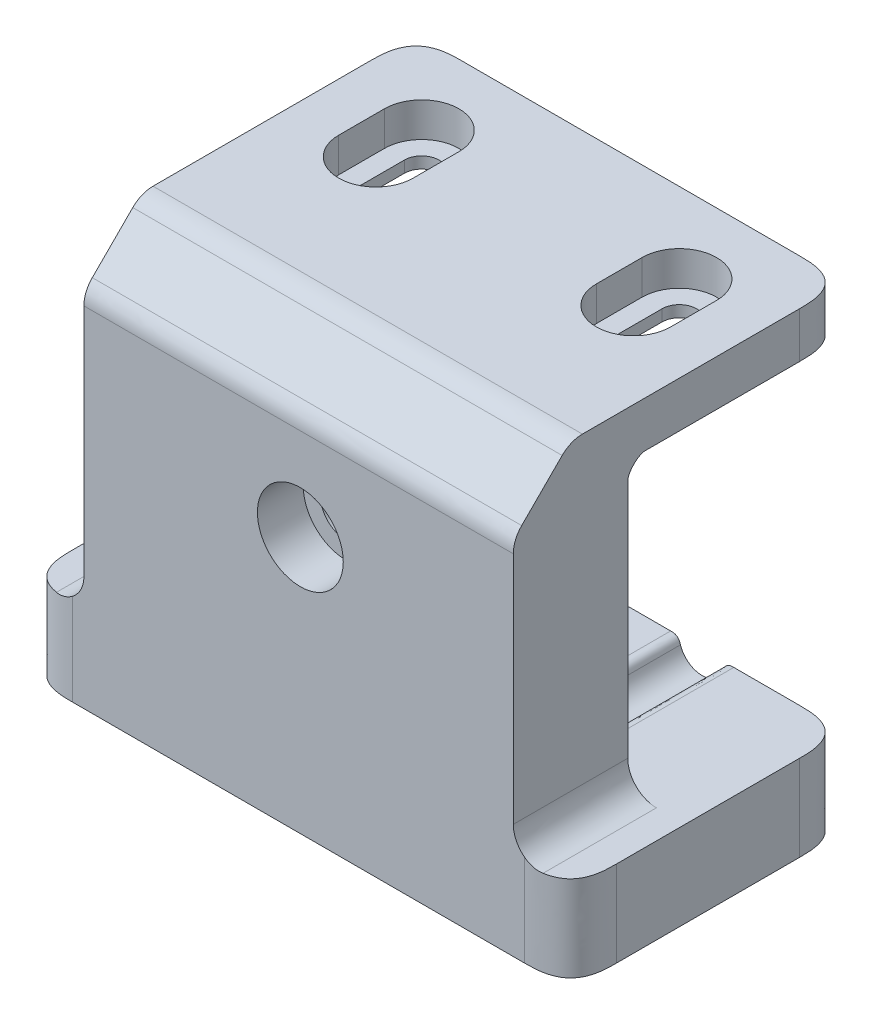
from build123d import *

# Parameters (mm, degrees)
BOSS_EXTRUDE1_DEPTH            = 37.5
SKETCH2_W                      = 10
SKETCH2_H                      = 58
BOSS_EXTRUDE2_DEPTH            = 15
CUT_EXTRUDE1_DEPTH             = 60
SKETCH4_W                      = 117.065560194
SKETCH4_H                      = 19.652824348
CUT_EXTRUDE2_DEPTH             = 60
FILLET2_SIZE                   = 5
FILLET3_SIZE                   = 3
FILLET4_SIZE                   = 8
CUT_EXTRUDE3_DEPTH             = 6
SKETCH6_R                      = 4
CUT_EXTRUDE4_DEPTH             = 28
FILLET5_START                  = 9
FILLET5_DEPTH                  = 29
CBORE_FOR_M8_SHCS1_D           = 9
CBORE_FOR_M8_SHCS1_CBORE_D     = 15
CBORE_FOR_M8_SHCS1_CBORE_DEPTH = 8


with BuildPart() as part:
    # Sketch1 → Boss-Extrude1 (new, symmetric)
    with BuildSketch(Plane(origin=(0, 0, 0), x_dir=(0, 0, -1), z_dir=(1, 0, 0))):
        Polygon((0, 0), (-38, 0), (-38, 50), (0, 50), (0, 58), (-48, 58), (-58, 48), (-58, -15), (0, -15), align=None)
    extrude(amount=BOSS_EXTRUDE1_DEPTH, both=True)

    # Sketch2 → Boss-Extrude2 (add)
    with BuildSketch(Plane(origin=(0, 0, 0), x_dir=(1, 0, 0), z_dir=(0, 1, 0))):
        with Locations((42.5, -29)):
            Rectangle(SKETCH2_W, SKETCH2_H)
        with Locations((-42.5, -29)):
            Rectangle(SKETCH2_W, SKETCH2_H)
    extrude(amount=-BOSS_EXTRUDE2_DEPTH)

    # Sketch3 → Cut-Extrude1 (cut)
    with BuildSketch(Plane(origin=(0, 58, 0), x_dir=(1, 0, 0), z_dir=(0, 1, 0))):
        with BuildLine():
            Line((25.5, -14), (25.5, -22))
            ThreePointArc((25.5, -22), (22.5, -25), (19.5, -22))
            Line((19.5, -22), (19.5, -14))
            ThreePointArc((19.5, -14), (22.5, -11), (25.5, -14))
        make_face()
        with BuildLine():
            Line((-25.5, -14), (-25.5, -22))
            ThreePointArc((-25.5, -22), (-22.5, -25), (-19.5, -22))
            Line((-19.5, -22), (-19.5, -14))
            ThreePointArc((-19.5, -14), (-22.5, -11), (-25.5, -14))
        make_face()
    extrude(amount=-CUT_EXTRUDE1_DEPTH, mode=Mode.SUBTRACT)

    # Sketch4 → Cut-Extrude2 (cut)
    with BuildSketch(Plane(origin=(0, 0, 0), x_dir=(1, 0, 0), z_dir=(0, 1, 0))):
        with Locations((0.461167358, -0.173587826)):
            Rectangle(SKETCH4_W, SKETCH4_H)
    extrude(amount=-CUT_EXTRUDE2_DEPTH, mode=Mode.SUBTRACT)

    # Fillet2
    # a fillet whose section is not a circle: 5 mm, written as the material it adds along each edge
    with BuildSketch(Plane(origin=(37.5, 0, 58), x_dir=(1, 0, 0), z_dir=(0, 0, -1))) as fillet2_piece_1:
        with BuildLine():
            Bezier((FILLET2_SIZE, 0), (0, 0), (0, -FILLET2_SIZE), weights=[1, 0.707106781, 1])
            Line((0, -FILLET2_SIZE), (0, 0))
            Line((0, 0), (FILLET2_SIZE, 0))
        make_face()
    extrude(amount=20)
    with BuildSketch(Plane(origin=(-37.5, 0, 58), x_dir=(-1, 0, 0), z_dir=(0, 0, -1))) as fillet2_piece_2:
        with BuildLine():
            Bezier((FILLET2_SIZE, 0), (0, 0), (0, FILLET2_SIZE), weights=[1, 0.707106781, 1])
            Line((0, FILLET2_SIZE), (0, 0))
            Line((0, 0), (FILLET2_SIZE, 0))
        make_face()
    extrude(amount=20)
    # a fillet whose section is not a circle: 5 mm, written as the material it takes off along each edge
    with BuildSketch(Plane(origin=(-42.67766953, 48, 58), x_dir=(0, 0.7071067811865492, -0.7071067811865458), z_dir=(1, 0, 0)), Plane(origin=(-42.67766953, 58, 48), x_dir=(0, 0, -1), z_dir=(1, 0, 0))) as fillet2_2_piece_1:
        with BuildLine():
            Bezier((2.071067812, 0), (0, 0), (-1.464466094, -1.464466094), weights=[1, 0.923879533, 1])
            Line((-1.464466094, -1.464466094), (0, 0))
            Line((0, 0), (2.071067812, 0))
        make_face()
    extrude(amount=85.355339059, mode=Mode.SUBTRACT)

    # Fillet3
    # a fillet whose section is not a circle: 3 mm, written as the material it adds along each edge
    with BuildSketch(Plane(origin=(-37.5, 50, 38), x_dir=(0, -1, 0), z_dir=(1, 0, 0))) as fillet3_piece_1:
        with BuildLine():
            Bezier((FILLET3_SIZE, 0), (0, 0), (0, FILLET3_SIZE), weights=[1, 0.424264069, 1])
            Line((0, FILLET3_SIZE), (0, 0))
            Line((0, 0), (FILLET3_SIZE, 0))
        make_face()
    extrude(amount=75)

    # Fillet4
    # a fillet whose section is not a circle: 8 mm, written as the material it takes off along each edge
    with BuildSketch(Plane(origin=(-37.5, 30, 0), x_dir=(0, 0, 1), z_dir=(0, 1, 0))) as fillet4_piece_1:
        with BuildLine():
            add(Edge.make_bspline([(FILLET4_SIZE, 0), (FILLET4_SIZE * 0.831801948466, 0), (FILLET4_SIZE * 0.663603896932, 0), (FILLET4_SIZE * 0.292893218813, FILLET4_SIZE * 0.0716919198361), (FILLET4_SIZE * 0.0716919198361, FILLET4_SIZE * 0.292893218813), (0, FILLET4_SIZE * 0.663603896932), (0, FILLET4_SIZE * 0.831801948466), (0, FILLET4_SIZE)], knots=[0, 0, 0, 0, 0, 0, 0.5, 0.5, 1, 1, 1, 1, 1, 1], degree=5))
            Line((0, FILLET4_SIZE), (0, 0))
            Line((0, 0), (FILLET4_SIZE, 0))
        make_face()
    extrude(amount=48, mode=Mode.SUBTRACT)
    with BuildSketch(Plane(origin=(37.5, 30, 0), x_dir=(0, 0, 1), z_dir=(0, 1, 0))) as fillet4_piece_2:
        with BuildLine():
            add(Edge.make_bspline([(FILLET4_SIZE, 0), (FILLET4_SIZE * 0.831801948466, 0), (FILLET4_SIZE * 0.663603896932, 0), (FILLET4_SIZE * 0.292893218813, -FILLET4_SIZE * 0.0716919198361), (FILLET4_SIZE * 0.0716919198361, -FILLET4_SIZE * 0.292893218813), (0, -FILLET4_SIZE * 0.663603896932), (0, -FILLET4_SIZE * 0.831801948466), (0, -FILLET4_SIZE)], knots=[0, 0, 0, 0, 0, 0, 0.5, 0.5, 1, 1, 1, 1, 1, 1], degree=5))
            Line((0, -FILLET4_SIZE), (0, 0))
            Line((0, 0), (FILLET4_SIZE, 0))
        make_face()
    extrude(amount=48, mode=Mode.SUBTRACT)
    with BuildSketch(Plane(origin=(-47.5, 20, 58), x_dir=(0, 0, -1), z_dir=(0, -1, 0)), Plane(origin=(47.5, 20, 58), x_dir=(-1, 0, 0), z_dir=(0, -1, 0)), Plane(origin=(47.5, 20, 10), x_dir=(0, 0, 1), z_dir=(0, -1, 0))) as fillet4_piece_3:
        with BuildLine():
            add(Edge.make_bspline([(FILLET4_SIZE, 0), (FILLET4_SIZE * 0.831801948466, 0), (FILLET4_SIZE * 0.663603896932, 0), (FILLET4_SIZE * 0.292893218813, FILLET4_SIZE * 0.0716919198361), (FILLET4_SIZE * 0.0716919198361, FILLET4_SIZE * 0.292893218813), (0, FILLET4_SIZE * 0.663603896932), (0, FILLET4_SIZE * 0.831801948466), (0, FILLET4_SIZE)], knots=[0, 0, 0, 0, 0, 0, 0.5, 0.5, 1, 1, 1, 1, 1, 1], degree=5))
            Line((0, FILLET4_SIZE), (0, 0))
            Line((0, 0), (FILLET4_SIZE, 0))
        make_face()
    extrude(amount=55, mode=Mode.SUBTRACT)
    with BuildSketch(Plane(origin=(-47.5, 20, 10), x_dir=(0, 0, 1), z_dir=(0, -1, 0))) as fillet4_piece_4:
        with BuildLine():
            add(Edge.make_bspline([(FILLET4_SIZE, 0), (FILLET4_SIZE * 0.831801948466, 0), (FILLET4_SIZE * 0.663603896932, 0), (FILLET4_SIZE * 0.292893218813, -FILLET4_SIZE * 0.0716919198361), (FILLET4_SIZE * 0.0716919198361, -FILLET4_SIZE * 0.292893218813), (0, -FILLET4_SIZE * 0.663603896932), (0, -FILLET4_SIZE * 0.831801948466), (0, -FILLET4_SIZE)], knots=[0, 0, 0, 0, 0, 0, 0.5, 0.5, 1, 1, 1, 1, 1, 1], degree=5))
            Line((0, -FILLET4_SIZE), (0, 0))
            Line((0, 0), (FILLET4_SIZE, 0))
        make_face()
    extrude(amount=55, mode=Mode.SUBTRACT)

    # Sketch5 → Cut-Extrude3 (cut)
    with BuildSketch(Plane(origin=(0, 58, 0), x_dir=(1, 0, 0), z_dir=(0, 1, 0))):
        with BuildLine():
            Line((29, -22), (29, -14))
            ThreePointArc((29, -14), (22.5, -7.5), (16, -14))
            Line((16, -14), (16, -22))
            ThreePointArc((16, -22), (22.5, -28.5), (29, -22))
        make_face()
        with BuildLine():
            Line((-29, -14), (-29, -22))
            ThreePointArc((-29, -22), (-22.5, -28.5), (-16, -22))
            Line((-16, -22), (-16, -14))
            ThreePointArc((-16, -14), (-22.5, -7.5), (-29, -14))
        make_face()
    extrude(amount=-CUT_EXTRUDE3_DEPTH, mode=Mode.SUBTRACT)

    # Sketch6 → Cut-Extrude4 (cut)
    with BuildSketch(Plane(origin=(0, 0, 10), x_dir=(-1, 0, 0), z_dir=(0, 0, -1))):
        with Locations((-22.5, 0)):
            Circle(SKETCH6_R)
        with Locations((22.5, 0)):
            Circle(SKETCH6_R)
    extrude(amount=-CUT_EXTRUDE4_DEPTH, mode=Mode.SUBTRACT)

    # Fillet5: read off the stored shape, not the designer's step
    # Fillet5 outline → Fillet5 (cut)
    with BuildSketch(Plane.XY.offset(FILLET5_START)):
        with BuildLine():
            Line((-26.5, 0), (-28.013619501, 0))
            add(Edge.make_bspline(
                [(-28.013619501, 0), (-27.784244034, 0), (-27.554868567, 0), (-27.062715359, -0.070865603), (-26.665077166, -0.330381163), (-26.417016996, -0.854445797), (-26.36129252, -1.061279034), (-26.302496207, -1.24137931)],
                knots=[0, 0, 0, 0, 0, 0, 0.5, 0.5, 1, 1, 1, 1, 1, 1], degree=5))
            ThreePointArc((-26.302496207, -1.24137931), (-26.450315483, -0.628496289), (-26.5, 0))
        make_face()
        with BuildLine():
            Line((18.5, 0), (16.986380499, 0))
            add(Edge.make_bspline(
                [(16.986380499, 0), (17.215755966, 0), (17.445131433, 0), (17.937284641, -0.070865603), (18.334922834, -0.330381163), (18.582983004, -0.854445797), (18.63870748, -1.061279034), (18.697503793, -1.24137931)],
                knots=[0, 0, 0, 0, 0, 0, 0.5, 0.5, 1, 1, 1, 1, 1, 1], degree=5))
            ThreePointArc((18.697503793, -1.24137931), (18.549684517, -0.628496289), (18.5, 0))
        make_face()
        with BuildLine():
            ThreePointArc((26.5, 0), (26.450315483, -0.628496289), (26.302496208, -1.24137931))
            add(Edge.make_bspline(
                [(26.302496208, -1.24137931), (26.36129252, -1.061279034), (26.417016996, -0.854445797), (26.665077166, -0.330381163), (27.062715359, -0.070865603), (27.554868567, 0), (27.784244034, 0), (28.013619501, 0)],
                knots=[0, 0, 0, 0, 0, 0, 0.5, 0.5, 1, 1, 1, 1, 1, 1], degree=5))
            Line((28.013619501, 0), (26.5, 0))
        make_face()
        with BuildLine():
            ThreePointArc((-18.5, 0), (-18.549684517, -0.628496289), (-18.697503792, -1.24137931))
            add(Edge.make_bspline(
                [(-18.697503792, -1.24137931), (-18.63870748, -1.061279034), (-18.582983004, -0.854445797), (-18.334922834, -0.330381163), (-17.937284641, -0.070865603), (-17.445131433, 0), (-17.215755966, 0), (-16.986380499, 0)],
                knots=[0, 0, 0, 0, 0, 0, 0.5, 0.5, 1, 1, 1, 1, 1, 1], degree=5))
            Line((-16.986380499, 0), (-18.5, 0))
        make_face()
    extrude(amount=FILLET5_DEPTH, mode=Mode.SUBTRACT)

    # CBORE for M8 SHCS1 (through all)
    with Locations(Plane.XY.offset(58)):
        with Locations((0.303900377, 29.852)):
            CounterBoreHole(CBORE_FOR_M8_SHCS1_D / 2, CBORE_FOR_M8_SHCS1_CBORE_D / 2, CBORE_FOR_M8_SHCS1_CBORE_DEPTH)


solid = part.part
